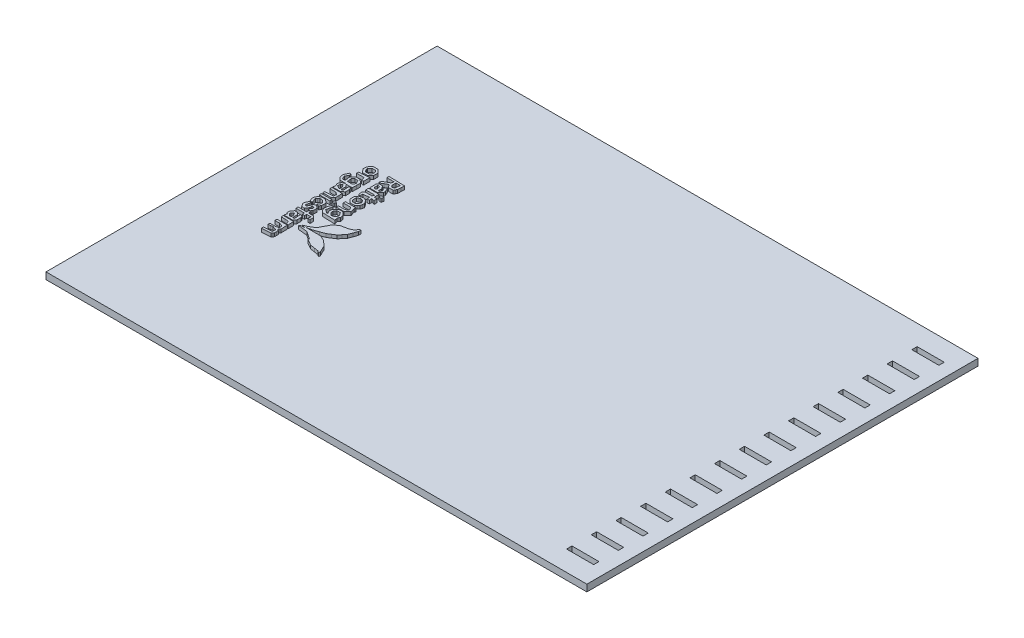
from build123d import *

# Parameters (mm, degrees)
SKETCH1_W           = 203.2
SKETCH1_H           = 146.939
BOSS_EXTRUDE1_DEPTH = 2.54
SKETCH2_W           = 2
SKETCH2_H           = 10.16
CUT_EXTRUDE1_DEPTH  = 2.794
LPATTERN1_COUNT     = 15
LPATTERN1_PITCH     = 9.264214286
BOSS_EXTRUDE2_DEPTH = 1.27


with BuildPart() as part:
    # Sketch1 → Boss-Extrude1 (new body)
    with BuildSketch(Plane(origin=(0, 0, 0), x_dir=(1, 0, 0), z_dir=(0, 1, 0))):
        with Locations((35.207920792, -46.991886139)):
            Rectangle(SKETCH1_W, SKETCH1_H)
    extrude(amount=BOSS_EXTRUDE1_DEPTH)

    # Sketch2 → Cut-Extrude1 (cut)
    with BuildSketch(Plane(origin=(0, 2.54, 0), x_dir=(0, 0, -1), z_dir=(0, 1, 0))):
        with Locations((-111.841386139, -126.647920792)):
            Rectangle(SKETCH2_W, SKETCH2_H)
    cut_extrude1 = extrude(amount=-CUT_EXTRUDE1_DEPTH, mode=Mode.SUBTRACT)

    # LPattern1: Cut-Extrude1 ×15
    with Locations(*[(0, 0, -i * LPATTERN1_PITCH) for i in range(1, LPATTERN1_COUNT)]):
        add(cut_extrude1, mode=Mode.SUBTRACT)

    # Sketch6 → Boss-Extrude2 (add)
    # profile 1 of 20: a face of its own
    with BuildSketch(Plane(origin=(0, 2.54, 0), x_dir=(1, 0, 0), z_dir=(0, 1, 0))):
        Polygon((-40.838764807, -35.000952541), (-40.694137208, -35.662419339), (-40.204374408, -36.161529338), (-39.714611608, -36.660613939), (-38.568055608, -36.660613939), (-37.421525008, -36.660613939), (-37.998892407, -36.874202538), (-38.576234408, -37.087791139), (-38.872779408, -37.641866739), (-39.169324408, -38.195942339), (-38.971661608, -38.781259939), (-38.773998808, -39.366577539), (-38.841334208, -39.829619538), (-38.908695008, -40.292636139), (-37.495718408, -40.292636139), (-36.082741808, -40.292636139), (-35.494706408, -39.880749739), (-34.906671008, -39.468863339), (-34.906671008, -38.711765539), (-34.906671008, -37.954667739), (-35.067275208, -37.536151939), (-35.227879408, -37.117636139), (-35.580380608, -37.117636139), (-35.932907208, -37.117636139), (-35.882818408, -38.213646139), (-35.832704208, -39.309656139), (-36.163437608, -39.426318339), (-36.494171008, -39.542980539), (-36.494171008, -38.613772339), (-36.494171008, -37.684589539), (-36.909943608, -37.268816939), (-37.325716208, -36.853044339), (-36.144641608, -36.853044339), (-34.963541608, -36.853044339), (-34.941418208, -35.27979374), (-34.919269408, -33.706543139), (-35.610098604, -33.163135542), (-36.300953208, -32.619702539), (-37.012889808, -32.619702539), (-37.724851808, -32.619702539), (-38.330972008, -33.264913339), (-38.937117608, -33.910098739), (-38.827110208, -34.852413342), (-38.717102808, -35.794702539), (-39.198813808, -35.794702539), (-39.680524808, -35.794702539), (-39.976968208, -35.144081539), (-40.273411608, -34.493460539), (-39.880092608, -33.887314939), (-39.486773608, -33.281169339), (-39.600032208, -32.950435939), (-39.713265408, -32.619702539), (-39.968586208, -32.619702539), (-40.223881608, -32.619702539), (-40.603637008, -33.479619539), (-40.983392408, -34.339511139), align=None)
        Polygon((-38.346262808, -38.446843539), (-38.346262808, -37.942602739), (-38.041539008, -37.754287138), (-37.736815208, -37.565946139), (-37.380072208, -38.053803939), (-37.023329208, -38.541687139), (-37.023329208, -39.020273939), (-37.023329208, -39.498886139), (-37.173011408, -39.498886139), (-37.322719008, -39.498886139), (-37.834478208, -39.224997939), (-38.346262808, -38.951084339), align=None, mode=Mode.SUBTRACT)
        Polygon((-38.027442008, -34.867373939), (-38.105521608, -34.072303139), (-37.776109008, -33.742890539), (-37.446671008, -33.413452539), (-36.832448208, -33.413452539), (-36.218250808, -33.413452539), (-35.907507208, -34.095467939), (-35.596763608, -34.777483339), (-35.875858808, -35.219951339), (-36.154979408, -35.662419339), (-37.052183608, -35.662419339), (-37.949387808, -35.662419339), align=None, mode=Mode.SUBTRACT)
    # profile 2 of 20: a face of its own
    with BuildSketch(Plane(origin=(0, 2.54, 0), x_dir=(1, 0, 0), z_dir=(0, 1, 0))):
        Polygon((-39.119108608, -28.152248939), (-39.140012808, -28.579603939), (-38.591626808, -29.276732339), (-38.043266208, -29.973886139), (-37.004126808, -29.973886139), (-35.965012808, -29.973886139), (-35.435829208, -29.444702539), (-34.906671008, -28.915544339), (-34.906671008, -28.072696139), (-34.906671008, -27.229847939), (-35.481955609, -26.617504738), (-36.057240208, -26.005136139), (-37.028460008, -26.005136139), (-37.999654408, -26.005136139), (-38.403006408, -26.468152739), (-38.806358408, -26.931169339), (-38.952306808, -27.328044338), (-39.098229808, -27.724919339), align=None)
        Polygon((-38.346262808, -27.893499139), (-38.346262808, -27.630431339), (-37.930490208, -27.214658739), (-37.514717608, -26.798886139), (-36.925056608, -26.798886139), (-36.335421008, -26.798886139), (-36.017921008, -27.116386139), (-35.700421008, -27.433886139), (-35.700421008, -27.989511139), (-35.700421008, -28.545136139), (-36.017921008, -28.862636139), (-36.335421008, -29.180136139), (-37.066941008, -29.180136139), (-37.798461008, -29.180136139), (-38.072374609, -28.668351537), (-38.346262808, -28.156592339), align=None, mode=Mode.SUBTRACT)
    # profile 3 of 20: a face of its own
    with BuildSketch(Plane(origin=(0, 2.54, 0), x_dir=(1, 0, 0), z_dir=(0, 1, 0))):
        Polygon((-39.123248808, -47.652209939), (-39.140012808, -48.000342339), (-38.866124608, -48.512101539), (-38.592211008, -49.023886139), (-38.176362208, -49.023886139), (-37.760462608, -49.023886139), (-37.951089609, -48.560869537), (-38.141716608, -48.097827539), (-38.264525608, -47.674257139), (-38.387334608, -47.250686739), (-37.951038808, -46.814365538), (-37.514717608, -46.378044339), (-37.023329208, -46.378044339), (-36.531966208, -46.378044339), (-36.116193608, -46.793816939), (-35.700421008, -47.209589539), (-35.700421008, -47.666941939), (-35.700421008, -48.124294339), (-36.009259608, -48.433132939), (-36.318072808, -48.741946139), (-35.850255608, -48.921473339), (-35.382438408, -49.100975139), (-35.148606008, -48.731709939), (-34.914773608, -48.362419339), (-34.910735008, -47.521730139), (-34.906671008, -46.681040939), (-35.603824811, -46.132654936), (-36.300953208, -45.584294339), (-36.944132008, -45.584294339), (-37.587310808, -45.584294339), (-38.114005208, -45.866183539), (-38.640699608, -46.148047339), (-38.873592208, -46.726075139), (-39.106459408, -47.304077539), align=None)
    # profile 4 of 20: a face of its own
    with BuildSketch(Plane(origin=(0, 2.54, 0), x_dir=(1, 0, 0), z_dir=(0, 1, 0))):
        Polygon((-39.122105808, -50.883242339), (-39.140089008, -51.287381739), (-38.728202608, -51.875417139), (-38.316240008, -52.463452539), (-37.817079208, -52.463452539), (-37.317918408, -52.463452539), (-36.906057408, -51.875417139), (-36.494171008, -51.287381739), (-36.494171008, -50.817100739), (-36.494171008, -50.346794339), (-36.097296008, -50.346794339), (-35.700421008, -50.346794339), (-35.700421008, -50.728048339), (-35.700421008, -51.109327739), (-35.965012808, -51.272827539), (-36.229579208, -51.436352739), (-36.229579208, -51.693629339), (-36.229579208, -51.950905939), (-35.806008808, -52.113440539), (-35.382438408, -52.275975139), (-35.148606008, -51.906709939), (-34.914773608, -51.537419339), (-34.910735008, -50.850831939), (-34.906671008, -50.164219139), (-35.425999409, -49.694242938), (-35.945302408, -49.224292139), (-36.363970607, -49.384947138), (-36.782664208, -49.545602139), (-37.178777208, -50.493682539), (-37.574915608, -51.441762939), (-37.894447608, -51.328809139), (-38.213979608, -51.215880739), (-38.164754408, -50.847479139), (-38.115554608, -50.479077539), (-37.935468608, -49.883777738), (-37.755382608, -49.288452539), (-38.142681808, -49.288452539), (-38.529981008, -49.288452539), (-38.817102608, -49.883777739), (-39.104198808, -50.479077539), align=None)
    # profile 5 of 20: a face of its own
    with BuildSketch(Plane(origin=(0, 2.54, 0), x_dir=(1, 0, 0), z_dir=(0, 1, 0))):
        Polygon((-39.140089008, -56.740050539), (-39.140089008, -57.194735939), (-38.900338408, -57.342894139), (-38.660587808, -57.491077739), (-38.798916208, -58.019981939), (-38.937219208, -58.548886139), (-37.337755808, -58.548886139), (-35.738292408, -58.548886139), (-35.322519808, -58.133113539), (-34.906747208, -57.717340939), (-34.906747208, -56.964129339), (-34.906747208, -56.210917739), (-35.067351408, -55.792401939), (-35.227955608, -55.373886139), (-35.601310208, -55.373886139), (-35.974690208, -55.373886139), (-35.903748009, -56.469845326), (-35.832805808, -57.565829939), (-36.163513808, -57.682517539), (-36.494247208, -57.799230539), (-36.494247208, -56.870022339), (-36.494247208, -55.940839539), (-36.910019808, -55.525066939), (-37.325792408, -55.109294339), (-37.821067008, -55.109294339), (-38.316341608, -55.109294339), (-38.728202608, -55.697329738), (-39.140089008, -56.285365139), align=None)
        Polygon((-38.346339008, -56.808554339), (-38.346339008, -56.496997939), (-37.967904408, -56.182952339), (-37.589495208, -55.868881339), (-37.306463008, -56.397734739), (-37.023430808, -56.926588139), (-37.023430808, -57.340862139), (-37.023430808, -57.755136139), (-37.367372208, -57.755136139), (-37.711339008, -57.755136139), (-38.028839008, -57.437636139), (-38.346339008, -57.120136139), align=None, mode=Mode.SUBTRACT)
    # profile 6 of 20: a face of its own
    with BuildSketch(Plane(origin=(0, 2.54, 0), x_dir=(1, 0, 0), z_dir=(0, 1, 0))):
        Polygon((-38.875421008, -30.899919339), (-38.875421008, -31.296794339), (-37.425258808, -31.296794339), (-35.975096608, -31.296794339), (-35.809056808, -31.958261138), (-35.643042408, -32.619702539), (-35.284521408, -32.619702539), (-34.925975008, -32.619702539), (-34.950536807, -31.396286195), (-34.975098608, -30.172844339), (-36.329934607, -30.335658339), (-37.684796008, -30.498446939), (-38.280095808, -30.500758339), (-38.875421008, -30.503044339), align=None)
    # profile 7 of 20: a face of its own
    with BuildSketch(Plane(origin=(0, 2.54, 0), x_dir=(1, 0, 0), z_dir=(0, 1, 0))):
        Polygon((-38.875421008, -40.954077539), (-38.875421008, -41.350952539), (-37.735367408, -41.350952539), (-36.595313808, -41.350952539), (-36.119089207, -41.699186539), (-35.642890008, -42.047395139), (-35.740375208, -42.559078139), (-35.837860408, -43.070761139), (-37.356627998, -43.150110738), (-38.875421008, -43.229460339), (-38.875421008, -43.613127339), (-38.875421008, -43.996794339), (-37.306818608, -43.996794339), (-35.738216208, -43.996794339), (-35.327523608, -43.586101739), (-34.916805608, -43.175383739), (-34.946320408, -41.866293138), (-34.975809808, -40.557202539), (-36.925615408, -40.557202539), (-38.875421008, -40.557202539), align=None)
    # profile 8 of 20: a face of its own
    with BuildSketch(Plane(origin=(0, 2.54, 0), x_dir=(1, 0, 0), z_dir=(0, 1, 0))):
        Polygon((-38.875421008, -44.922827539), (-38.875421008, -45.319702539), (-36.891046008, -45.319702539), (-34.906671008, -45.319702539), (-34.906671008, -44.922827539), (-34.906671008, -44.525952539), (-36.891046008, -44.525952539), (-38.875421008, -44.525952539), align=None)
    # profile 9 of 20: a face of its own
    with BuildSketch(Plane(origin=(0, 2.54, 0), x_dir=(1, 0, 0), z_dir=(0, 1, 0))):
        Polygon((-38.875421008, -53.654077539), (-38.875421008, -54.050952539), (-37.287921008, -54.050952539), (-35.700421008, -54.050952539), (-35.700421008, -54.447827539), (-35.700421008, -54.844702539), (-35.303546008, -54.844702539), (-34.906671008, -54.844702539), (-34.906671008, -54.447827539), (-34.906671008, -54.050952539), (-34.112921008, -54.050952539), (-33.319171008, -54.050952539), (-33.319171008, -54.580136139), (-33.319171008, -55.109294339), (-32.922296008, -55.109294339), (-32.525421008, -55.109294339), (-32.525421008, -54.500761139), (-32.525421008, -53.892202539), (-32.842921008, -53.574702539), (-33.160421008, -53.257202539), (-34.033546008, -53.257202539), (-34.906671008, -53.257202539), (-34.906671008, -52.860327539), (-34.906671008, -52.463452539), (-35.303546008, -52.463452539), (-35.700421008, -52.463452539), (-35.700421008, -52.860327539), (-35.700421008, -53.257202539), (-37.287921008, -53.257202539), (-38.875421008, -53.257202539), align=None)
    # profile 10 of 20: a face of its own
    with BuildSketch(Plane(origin=(0, 2.54, 0), x_dir=(1, 0, 0), z_dir=(0, 1, 0))):
        Polygon((-38.875421008, -59.196509939), (-38.875421008, -59.579567339), (-37.486345808, -59.659526539), (-36.097296008, -59.739511139), (-35.836107808, -60.334810939), (-35.574945008, -60.930136139), (-35.257394208, -60.930136139), (-34.939843408, -60.930136139), (-34.954448408, -59.871794339), (-34.969053408, -58.813452539), (-36.922237208, -58.813452539), (-38.875421008, -58.813452539), align=None)
    # profile 11 of 20: a face of its own
    with BuildSketch(Plane(origin=(0, 2.54, 0), x_dir=(1, 0, 0), z_dir=(0, 1, 0))):
        Polygon((-38.875446408, -61.591602939), (-38.875421008, -61.988452539), (-37.966609008, -61.988452539), (-37.057797008, -61.988452539), (-36.379109008, -62.246491139), (-35.700421008, -62.504529739), (-35.700421008, -63.009380139), (-35.700421008, -63.514255939), (-36.295746208, -63.673767939), (-36.891046008, -63.833330739), (-37.883246208, -63.836937539), (-38.875421008, -63.840569739), (-38.875421008, -64.220807739), (-38.875421008, -64.601045739), (-38.015529408, -64.464012739), (-37.155637808, -64.326954339), (-36.409690608, -64.613364739), (-35.663718008, -64.899749739), (-35.748223808, -65.494643139), (-35.832704208, -66.089536539), (-37.354062608, -66.168886139), (-38.875421008, -66.248235739), (-38.875421008, -66.662712939), (-38.875421008, -67.077215539), (-38.337404361, -67.042955026), (-35.399608808, -66.855879939), (-35.157191209, -66.47272094), (-34.914773608, -66.089536539), (-34.910735008, -65.377549139), (-34.906671008, -64.665536339), (-35.184115208, -64.494086339), (-35.461534008, -64.322610939), (-35.192776608, -63.998786339), (-34.924019208, -63.674936339), (-34.948911208, -62.434832139), (-34.973803208, -61.194727939), (-36.924624808, -61.194727939), (-38.875446408, -61.194727939), align=None)
    # profile 12 of 20: a face of its own
    with BuildSketch(Plane(origin=(0, 2.54, 0), x_dir=(1, 0, 0), z_dir=(0, 1, 0))):
        Polygon((-34.112921008, -44.938448539), (-34.112921008, -45.319702539), (-33.731667008, -45.319702539), (-33.350387608, -45.319702539), (-33.168599808, -45.025545139), (-32.986786608, -44.731387739), (-33.338779808, -44.513836739), (-33.690773008, -44.296285739), (-33.901847008, -44.426740139), (-34.112921008, -44.557194539), align=None)
    # profile 13 of 20: a face of its own
    with BuildSketch(Plane(origin=(0, 2.54, 0), x_dir=(1, 0, 0), z_dir=(0, 1, 0))):
        Polygon((-33.565855808, -48.399249339), (-33.583762808, -49.229829339), (-33.078150408, -49.854466139), (-32.572512608, -50.479077539), (-30.129616796, -50.572981339), (-27.686695608, -50.666885139), (-27.846029808, -50.057589939), (-28.005364008, -49.448294739), (-27.722306408, -49.107223539), (-27.439248808, -48.766177739), (-27.604298008, -48.108597139), (-27.769321808, -47.451016539), (-28.345190608, -46.914543139), (-28.921034008, -46.378044339), (-29.676938008, -46.378044339), (-30.432816608, -46.378044339), (-31.082243808, -47.027471539), (-31.731671008, -47.676898739), (-31.731671008, -48.235495539), (-31.731671008, -48.794092339), (-31.457782808, -49.305851539), (-31.183894608, -49.817636139), (-31.398905608, -49.817636139), (-31.613942008, -49.817636139), (-32.227199608, -49.388071339), (-32.840482608, -48.958531939), (-32.701646207, -48.263587935), (-32.562809808, -47.568669339), (-32.477973808, -47.067984539), (-32.393137808, -46.567299739), (-32.680107008, -46.465217139), (-32.967076208, -46.363134539), (-33.257499808, -46.965901939), (-33.547948808, -47.568669339), align=None)
        Polygon((-30.929869208, -48.519848539), (-30.921842808, -48.097827539), (-30.652145608, -47.634810939), (-30.382473808, -47.171794339), (-29.740260208, -47.171794339), (-29.098046608, -47.171794339), (-28.676254208, -47.815506538), (-28.254487208, -48.459218739), (-28.537595609, -48.98822454), (-28.820704008, -49.517204939), (-29.369115407, -49.691271138), (-29.917501408, -49.865311939), (-30.427711208, -49.403590739), (-30.937921008, -48.941869539), align=None, mode=Mode.SUBTRACT)
    # profile 14 of 20: a face of its own
    with BuildSketch(Plane(origin=(0, 2.54, 0), x_dir=(1, 0, 0), z_dir=(0, 1, 0))):
        Polygon((-31.066267208, -59.389575339), (-29.295430008, -59.568797739), (-27.867721408, -60.516751139), (-26.440012808, -61.464704539), (-26.440012808, -61.715427939), (-26.440012808, -61.966151339), (-25.315529408, -62.623554139), (-24.191046008, -63.280956939), (-22.510937609, -63.550298539), (-20.830854608, -63.819665539), (-20.460421008, -64.127081739), (-20.090012808, -64.434497939), (-20.092603608, -64.071379539), (-20.095194408, -63.708261139), (-20.717215008, -62.385327538), (-21.339261008, -61.062419339), (-22.316526008, -60.182995139), (-23.293816408, -59.303596339), (-24.271614806, -58.876165139), (-25.249387808, -58.448733939), (-27.970515208, -58.432655739), (-30.691642608, -58.416577539), (-29.702973008, -58.211142339), (-28.714328808, -58.005732539), (-26.849562408, -57.334562939), (-24.984821408, -56.663367939), (-23.721400008, -55.854479539), (-22.458004008, -55.045591139), (-21.570096208, -54.008280539), (-20.682213808, -52.970969939), (-20.121534207, -51.433279337), (-19.560829208, -49.895588739), (-19.560829208, -49.459724739), (-19.560829208, -49.023886139), (-19.816124608, -49.023886139), (-20.071394608, -49.023886139), (-20.353131408, -49.550301139), (-20.634868208, -50.076741539), (-21.420922008, -50.483217739), (-22.207001208, -50.889719339), (-23.57260681, -51.148697739), (-24.938187008, -51.407676139), (-25.809127608, -52.071962339), (-26.680042808, -52.736248539), (-27.664800807, -54.610235138), (-28.649533408, -56.484196339), (-29.674296408, -57.131108939), (-30.699059408, -57.777996139), (-31.413815407, -58.068267338), (-32.128546008, -58.358538539), (-31.467079209, -58.559630338), (-30.805637808, -58.760722139), (-31.621435008, -58.787087339), (-32.437232208, -58.813477939), (-32.637155609, -59.011902739), (-32.837104408, -59.210352939), align=None)
    # profile 15 of 20: a face of its own
    with BuildSketch(Plane(origin=(0, 2.54, 0), x_dir=(1, 0, 0), z_dir=(0, 1, 0))):
        Polygon((-31.731671008, -26.657916139), (-31.731671008, -27.063452539), (-30.389357208, -27.063452539), (-29.047043408, -27.063452539), (-29.135537008, -27.522938539), (-29.224005208, -27.982424539), (-30.365735208, -28.612242939), (-31.507465208, -29.242035939), (-31.652245208, -29.619378338), (-31.797050608, -29.996695339), (-31.672311208, -30.121434738), (-31.547546408, -30.246174139), (-30.298450607, -29.548055138), (-29.049354808, -28.849910739), (-28.655705608, -29.411885739), (-28.262081808, -29.973886139), (-27.360356408, -29.973886139), (-26.458631008, -29.973886139), (-26.158758608, -29.413562139), (-25.858886208, -28.853263539), (-25.818703408, -27.627637338), (-25.778546008, -26.402011139), (-28.755095807, -26.327182739), (-31.731671008, -26.252379739), align=None)
        Polygon((-28.288040608, -27.791060939), (-28.292079208, -27.063452539), (-27.482378008, -27.063452539), (-26.672651408, -27.063452539), (-26.754769608, -28.053442939), (-26.836887808, -29.043433339), (-27.334346808, -29.137819739), (-27.831805808, -29.232206139), (-28.057891208, -28.875437739), (-28.283976608, -28.518669339), align=None, mode=Mode.SUBTRACT)
    # profile 16 of 20: a face of its own
    with BuildSketch(Plane(origin=(0, 2.54, 0), x_dir=(1, 0, 0), z_dir=(0, 1, 0))):
        Polygon((-31.691285008, -32.40222774), (-31.662532208, -33.678044339), (-30.109601608, -33.678044339), (-28.556671008, -33.678044339), (-28.027512808, -33.148886139), (-27.498329208, -32.619702539), (-27.498329208, -32.235273539), (-27.498329208, -31.850869939), (-27.805389808, -31.176957139), (-28.112450408, -30.503044339), (-28.318952408, -30.503044339), (-28.525429008, -30.503044339), (-28.685576008, -30.762149739), (-28.845723008, -31.021280539), (-28.569853608, -31.536748139), (-28.293984208, -32.052215739), (-28.453623208, -32.468242339), (-28.613287608, -32.884294339), (-28.849558408, -32.884294339), (-29.085829208, -32.884294339), (-29.085829208, -32.281704739), (-29.085829208, -31.679115139), (-29.497715608, -31.091079739), (-29.909602008, -30.503044339), (-30.503123808, -30.503044339), (-31.096671008, -30.503044339), (-31.408354408, -30.814727739), (-31.720012408, -31.126385739), align=None)
        Polygon((-30.937921008, -31.966566939), (-30.937921008, -31.296794339), (-30.546075208, -31.296794339), (-30.154254808, -31.296794339), (-29.985141608, -31.970580139), (-29.816028408, -32.644365939), (-29.968682408, -32.797019939), (-30.121336408, -32.949673939), (-30.529641408, -32.792981339), (-30.937921008, -32.636314139), align=None, mode=Mode.SUBTRACT)
    # profile 17 of 20: a face of its own
    with BuildSketch(Plane(origin=(0, 2.54, 0), x_dir=(1, 0, 0), z_dir=(0, 1, 0))):
        Polygon((-31.731671008, -34.471794339), (-31.731671008, -35.000952539), (-30.020193608, -35.000952539), (-28.308690808, -35.000952539), (-28.460989208, -35.397827539), (-28.613287608, -35.794702539), (-29.875489808, -35.794702539), (-31.137717408, -35.794702539), (-31.455014208, -36.177023339), (-31.772285608, -36.559344139), (-31.685824008, -37.148497139), (-31.599387808, -37.737624739), (-31.268654408, -37.846565339), (-30.937921008, -37.955480539), (-30.937921008, -37.430894339), (-30.937921008, -36.906333539), (-29.747296008, -36.811642339), (-28.556671008, -36.716951139), (-28.556671008, -37.181872739), (-28.556671008, -37.646794339), (-28.159796008, -37.646794339), (-27.762921008, -37.646794339), (-27.762921008, -37.142401139), (-27.762921008, -36.638007939), (-27.233762807, -36.776387139), (-26.704579208, -36.914766339), (-26.704579208, -36.354747139), (-26.704579208, -35.794702539), (-27.233762808, -35.794702539), (-27.762921008, -35.794702539), (-27.762921008, -34.868669339), (-27.762921008, -33.942636139), (-29.747296008, -33.942636139), (-31.731671008, -33.942636139), align=None)
    # profile 18 of 20: a face of its own
    with BuildSketch(Plane(origin=(0, 2.54, 0), x_dir=(1, 0, 0), z_dir=(0, 1, 0))):
        Polygon((-31.731671008, -40.127713939), (-31.731671008, -40.919990739), (-31.156386408, -41.532333938), (-30.581101808, -42.144702539), (-29.701169608, -42.144702539), (-28.821262808, -42.144702539), (-28.298810208, -41.622275339), (-27.776383008, -41.099848139), (-27.608184208, -40.42971994), (-27.440010808, -39.759617139), (-27.879888008, -39.088269739), (-28.319765208, -38.416922339), (-28.967389008, -38.170694739), (-29.615012808, -37.924467139), (-30.342595807, -38.194418338), (-31.070204208, -38.464369539), (-31.400937608, -38.899903339), (-31.731671008, -39.335437139), align=None)
        Polygon((-30.937921008, -39.966601739), (-30.937921008, -39.217250939), (-30.352476408, -39.000665139), (-29.767031808, -38.784104739), (-29.285752607, -38.909961739), (-28.804498808, -39.035818739), (-28.529493008, -39.549660738), (-28.254487208, -40.063528139), (-28.676254208, -40.707240338), (-29.098046608, -41.350952539), (-29.700483808, -41.350952539), (-30.302921008, -41.350952539), (-30.620421008, -41.033452539), (-30.937921008, -40.715952539), align=None, mode=Mode.SUBTRACT)
    # profile 19 of 20: a face of its own
    with BuildSketch(Plane(origin=(0, 2.54, 0), x_dir=(1, 0, 0), z_dir=(0, 1, 0))):
        Polygon((-31.731671008, -43.070761139), (-31.731671008, -43.467636139), (-30.285776008, -43.467636139), (-28.839881008, -43.467636139), (-28.532490208, -44.041980939), (-28.225099408, -44.616351139), (-28.706023008, -44.968039539), (-29.186972008, -45.319702539), (-30.459334208, -45.319702539), (-31.731671008, -45.319702539), (-31.731671008, -45.716577539), (-31.731671008, -46.113452539), (-30.291211608, -46.113452539), (-28.850752208, -46.113452539), (-28.134497609, -45.49735014), (-27.418217608, -44.881222339), (-27.633660408, -44.108274939), (-27.849128608, -43.335327539), (-27.794417008, -43.004619539), (-27.739730808, -42.673886139), (-29.735688208, -42.673886139), (-31.731671008, -42.673886139), align=None)
    # profile 20 of 20: a face of its own
    with BuildSketch(Plane(origin=(0, 2.54, 0), x_dir=(1, 0, 0), z_dir=(0, 1, 0))):
        Polygon((-26.886494008, -34.587542139), (-26.792793408, -34.868669339), (-26.421572408, -34.868669339), (-26.050376808, -34.868669339), (-25.961197408, -34.405652738), (-25.872043408, -33.942636139), (-26.244204208, -33.942636139), (-26.616390408, -33.942636139), (-26.798305208, -34.124525539), (-26.980194608, -34.306440339), align=None)
    extrude(amount=BOSS_EXTRUDE2_DEPTH)


solid = part.part
